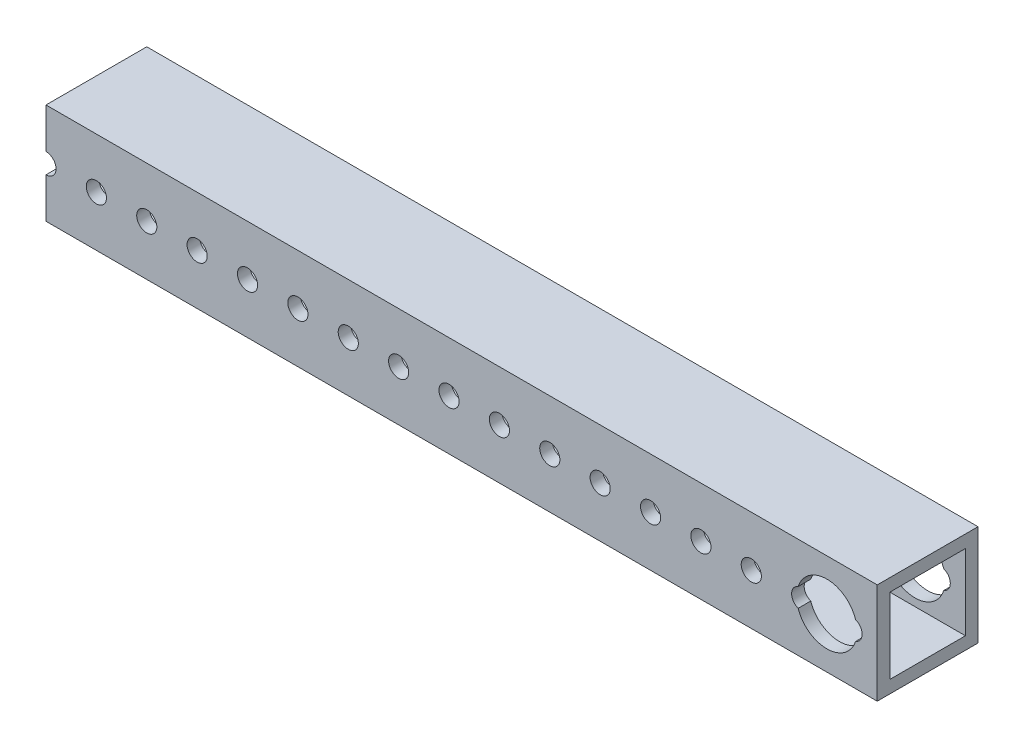
from build123d import *

# Parameters (mm, degrees)
SKETCH1_W           = 25.4
SKETCH1_H           = 25.4
SKETCH1_W_2         = 19.05
SKETCH1_H_2         = 19.05
INITIAL_STOCK_DEPTH = 209.55
SKETCH2_R           = 2.54
INITIAL_HOLE_DEPTH  = 212.465487728
HOLE_PATTERN_COUNT  = 17
HOLE_PATTERN_PITCH  = 12.7
SKETCH3_R           = 7.62
SHAFT_HOLE_DEPTH    = 212.465487728


with BuildPart() as part:
    # Sketch1 → Initial Stock (new body)
    with BuildSketch(Plane(origin=(0, 0, 0), x_dir=(0, 0, -1), z_dir=(1, 0, 0))):
        Rectangle(SKETCH1_W, SKETCH1_H)
        Rectangle(SKETCH1_W_2, SKETCH1_H_2, mode=Mode.SUBTRACT)
    extrude(amount=INITIAL_STOCK_DEPTH)

    # Sketch2 → Initial Hole (cut, through all)
    with BuildSketch(Plane.XY.offset(12.7)):
        Circle(SKETCH2_R)
    initial_hole = extrude(amount=-INITIAL_HOLE_DEPTH, mode=Mode.SUBTRACT)

    # Hole Pattern: Initial Hole ×17
    with Locations(*[(i * HOLE_PATTERN_PITCH, 0, 0) for i in range(1, HOLE_PATTERN_COUNT)]):
        add(initial_hole, mode=Mode.SUBTRACT)

    # Sketch3 → Shaft Hole (cut, through all)
    with BuildSketch(Plane.XY.offset(12.7)):
        with Locations((196.85, 0)):
            Circle(SKETCH3_R)
    extrude(amount=-SHAFT_HOLE_DEPTH, mode=Mode.SUBTRACT)


solid = part.part
